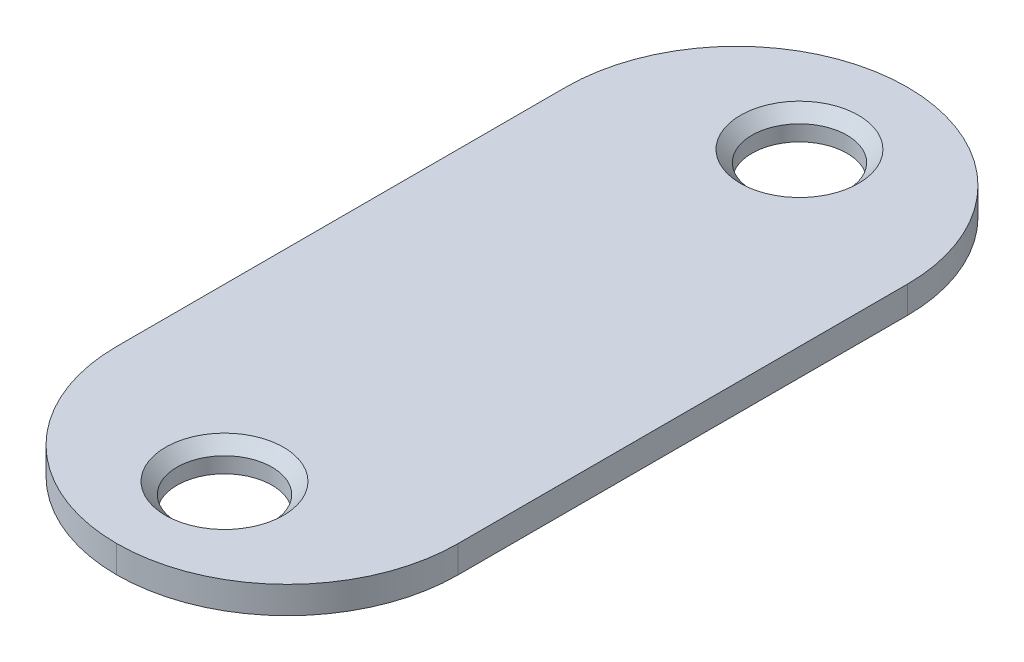
from build123d import *

# Parameters (mm, degrees)
SKETCH1_W      = 15.08125
SKETCH1_H      = 34.925
EXTRUDE1_DEPTH = 1.2
SKETCH3_R      = 2.1
EXTRUDE2_DEPTH = 1.984375
CHAMFER1_SIZE  = 0.508
FILLET1_R      = 7.540625
FILLET2_R      = 7.540625


with BuildPart() as part:
    # Sketch1 → Extrude1 (new body)
    with BuildSketch(Plane(origin=(0, 0, 0), x_dir=(1, 0, 0), z_dir=(0, 1, 0))):
        Rectangle(SKETCH1_W, SKETCH1_H)
    extrude(amount=EXTRUDE1_DEPTH)

    # Sketch3 → Extrude2 (cut)
    with BuildSketch(Plane(origin=(0, 1.2, 0), x_dir=(1, 0, 0), z_dir=(0, 1, 0))):
        with Locations(Location((0, 12.7, 0), (0, 0, 270))):
            Circle(SKETCH3_R)
        with Locations(Location((0, -12.7, 0), (0, 0, 270))):
            Circle(SKETCH3_R)
    extrude(amount=-EXTRUDE2_DEPTH, mode=Mode.SUBTRACT)

    # Chamfer1
    chamfer1_edges = [part.edges().sort_by_distance(p)[0] for p in [
        (0, 1.2, -14.8),
        (0, 1.2, 10.6),
    ]]
    chamfer(chamfer1_edges, length=CHAMFER1_SIZE)

    # Fillet1
    fillet1_edges = [part.edges().sort_by_distance(p)[0] for p in [
        (-7.540625, 0.6, -17.4625),
    ]]
    fillet(fillet1_edges, radius=FILLET1_R)

    # Fillet2
    fillet2_edges = [part.edges().sort_by_distance(p)[0] for p in [
        (7.540625, 0.6, 17.4625),
        (-7.540625, 0.6, 17.4625),
        (7.540625, 0.6, -17.4625),
    ]]
    fillet(fillet2_edges, radius=FILLET2_R - 0.0001)  # a hair under: the kernel refuses the full size


solid = part.part
